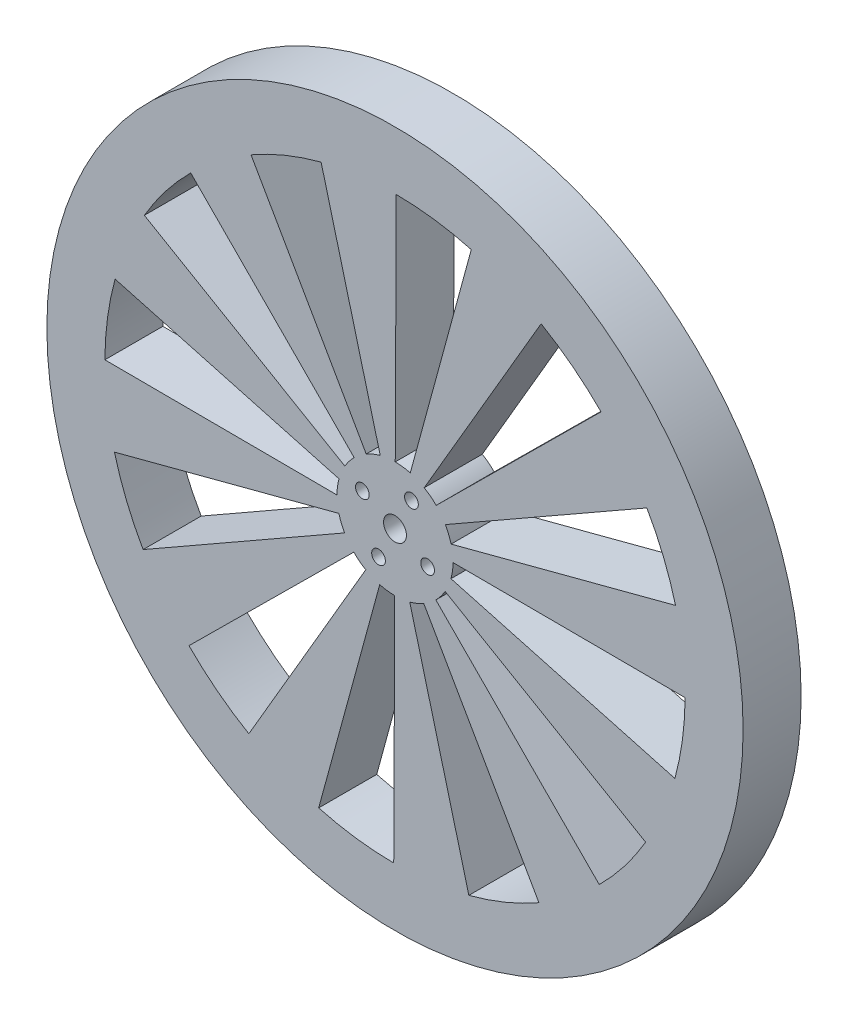
from build123d import *

# Parameters (mm, degrees)
SKETCH2_R           = 76.2
BOSS_EXTRUDE1_DEPTH = 12.7
CUT_EXTRUDE4_DEPTH  = 109.508847566
SKETCH4_R           = 1.5
CUT_EXTRUDE2_DEPTH  = 109.508847566
CIRPATTERN1_COUNT   = 4
SKETCH6_R           = 2.5
CUT_EXTRUDE5_DEPTH  = 109.508847566


with BuildPart() as part:
    # Sketch2 → Boss-Extrude1 (new body)
    with BuildSketch(Plane.XY):
        Circle(SKETCH2_R)
    extrude(amount=BOSS_EXTRUDE1_DEPTH)

    # Sketch5 → Cut-Extrude4 (cut, through all)
    with BuildSketch(Plane.XY.offset(12.7)):
        with BuildLine():
            Line((0.054779946, 12.699881856), (0.27389973, 63.49940928))
            ThreePointArc((0.27389973, 63.49940928), (8.559892582, 62.920411942), (16.699423298, 61.264828911))
            Line((16.699423298, 61.264828911), (3.33988466, 12.252965782))
            ThreePointArc((3.33988466, 12.252965782), (1.711978516, 12.584082388), (0.054779946, 12.699881856))
        make_face()
        with BuildLine():
            Line((9.018907852, 8.941437309), (45.09453926, 44.707186547))
            ThreePointArc((45.09453926, 44.707186547), (38.873290401, 50.210728868), (31.986908765, 54.855151697))
            Line((31.986908765, 54.855151697), (6.397381753, 10.971030339))
            ThreePointArc((6.397381753, 10.971030339), (7.77465808, 10.042145774), (9.018907852, 8.941437309))
        make_face()
        with BuildLine():
            Line((12.281321969, 3.23405793), (61.406609845, 16.170289651))
            ThreePointArc((61.406609845, 16.170289651), (58.770621449, 24.047121542), (55.129051427, 31.512500516))
            Line((55.129051427, 31.512500516), (11.025810285, 6.302500103))
            ThreePointArc((11.025810285, 6.302500103), (11.75412429, 4.809424308), (12.281321969, 3.23405793))
        make_face()
        with BuildLine():
            Line((12.252965782, -3.33988466), (61.264828911, -16.699423298))
            ThreePointArc((61.264828911, -16.699423298), (62.920411942, -8.559892582), (63.49940928, -0.27389973))
            Line((63.49940928, -0.27389973), (12.699881856, -0.054779946))
            ThreePointArc((12.699881856, -0.054779946), (12.584082388, -1.711978516), (12.252965782, -3.33988466))
        make_face()
        with BuildLine():
            Line((8.941437309, -9.018907852), (44.707186547, -45.09453926))
            ThreePointArc((44.707186547, -45.09453926), (50.210728868, -38.873290401), (54.855151697, -31.986908765))
            Line((54.855151697, -31.986908765), (10.971030339, -6.397381753))
            ThreePointArc((10.971030339, -6.397381753), (10.042145774, -7.77465808), (8.941437309, -9.018907852))
        make_face()
        with BuildLine():
            Line((3.23405793, -12.281321969), (16.170289651, -61.406609845))
            ThreePointArc((16.170289651, -61.406609845), (24.047121542, -58.770621449), (31.512500516, -55.129051427))
            Line((31.512500516, -55.129051427), (6.302500103, -11.025810285))
            ThreePointArc((6.302500103, -11.025810285), (4.809424308, -11.75412429), (3.23405793, -12.281321969))
        make_face()
        with BuildLine():
            Line((-3.33988466, -12.252965782), (-16.699423298, -61.264828911))
            ThreePointArc((-16.699423298, -61.264828911), (-8.559892582, -62.920411942), (-0.27389973, -63.49940928))
            Line((-0.27389973, -63.49940928), (-0.054779946, -12.699881856))
            ThreePointArc((-0.054779946, -12.699881856), (-1.711978516, -12.584082388), (-3.33988466, -12.252965782))
        make_face()
        with BuildLine():
            Line((-9.018907852, -8.941437309), (-45.09453926, -44.707186547))
            ThreePointArc((-45.09453926, -44.707186547), (-38.873290401, -50.210728868), (-31.986908765, -54.855151697))
            Line((-31.986908765, -54.855151697), (-6.397381753, -10.971030339))
            ThreePointArc((-6.397381753, -10.971030339), (-7.77465808, -10.042145774), (-9.018907852, -8.941437309))
        make_face()
        with BuildLine():
            Line((-12.281321969, -3.23405793), (-61.406609845, -16.170289651))
            ThreePointArc((-61.406609845, -16.170289651), (-58.770621449, -24.047121542), (-55.129051427, -31.512500516))
            Line((-55.129051427, -31.512500516), (-11.025810285, -6.302500103))
            ThreePointArc((-11.025810285, -6.302500103), (-11.75412429, -4.809424308), (-12.281321969, -3.23405793))
        make_face()
        with BuildLine():
            Line((-12.252965782, 3.33988466), (-61.264828911, 16.699423298))
            ThreePointArc((-61.264828911, 16.699423298), (-62.920411942, 8.559892582), (-63.49940928, 0.27389973))
            Line((-63.49940928, 0.27389973), (-12.699881856, 0.054779946))
            ThreePointArc((-12.699881856, 0.054779946), (-12.584082388, 1.711978516), (-12.252965782, 3.33988466))
        make_face()
        with BuildLine():
            Line((-8.941437309, 9.018907852), (-44.707186547, 45.09453926))
            ThreePointArc((-44.707186547, 45.09453926), (-50.210728868, 38.873290401), (-54.855151697, 31.986908765))
            Line((-54.855151697, 31.986908765), (-10.971030339, 6.397381753))
            ThreePointArc((-10.971030339, 6.397381753), (-10.042145774, 7.77465808), (-8.941437309, 9.018907852))
        make_face()
        with BuildLine():
            Line((-3.23405793, 12.281321969), (-16.170289651, 61.406609845))
            ThreePointArc((-16.170289651, 61.406609845), (-24.047121542, 58.770621449), (-31.512500516, 55.129051427))
            Line((-31.512500516, 55.129051427), (-6.302500103, 11.025810285))
            ThreePointArc((-6.302500103, 11.025810285), (-4.809424308, 11.75412429), (-3.23405793, 12.281321969))
        make_face()
    extrude(amount=-CUT_EXTRUDE4_DEPTH, mode=Mode.SUBTRACT)

    # Sketch4 → Cut-Extrude2 (cut, through all)
    with BuildSketch(Plane.XY.offset(12.7)):
        with Locations((3.605101695, 7.141655394)):
            Circle(SKETCH4_R)
    cut_extrude2 = extrude(amount=-CUT_EXTRUDE2_DEPTH, mode=Mode.SUBTRACT)

    # CirPattern1: Cut-Extrude2 ×4 about axis
    cirpattern1_axis = Axis((0, 0, 0), (0, 0, 1))
    for i in range(1, CIRPATTERN1_COUNT):
        add(cut_extrude2.rotate(cirpattern1_axis, i * 360 / CIRPATTERN1_COUNT), mode=Mode.SUBTRACT)

    # Sketch6 → Cut-Extrude5 (cut, through all)
    with BuildSketch(Plane.XY.offset(12.7)):
        Circle(SKETCH6_R)
    extrude(amount=-CUT_EXTRUDE5_DEPTH, mode=Mode.SUBTRACT)


solid = part.part
